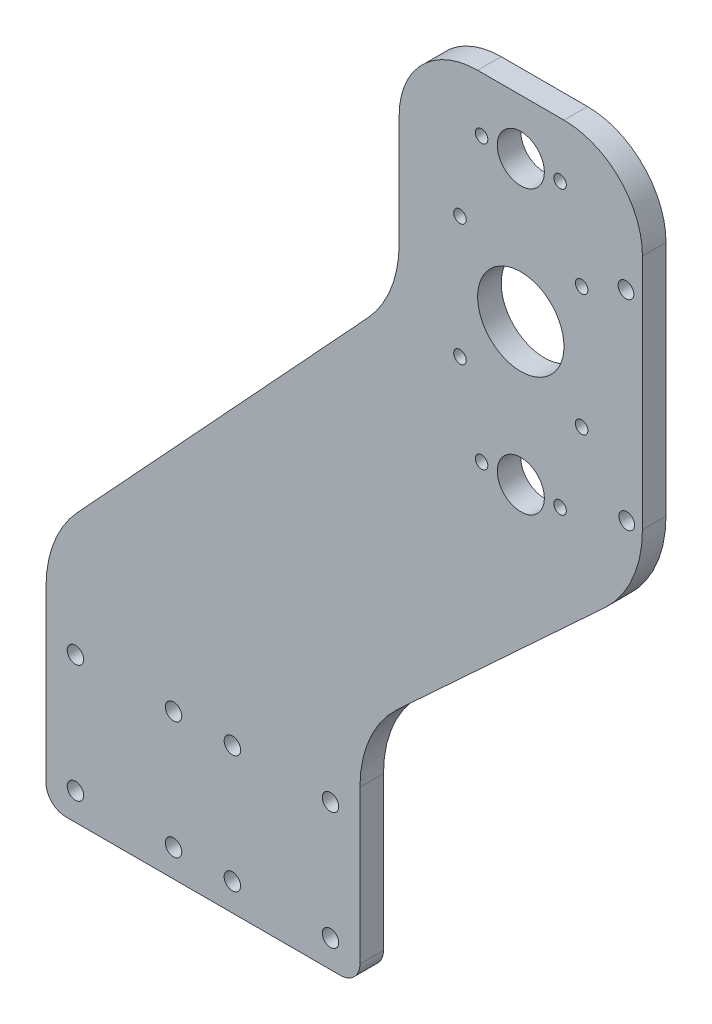
from build123d import *

# Parameters (mm, degrees)
SKETCH1_R           = 2.1
SKETCH1_R_2         = 6
SKETCH1_R_3         = 11
SKETCH1_R_4         = 1.6
SKETCH1_R_5         = 2
BOSS_EXTRUDE1_DEPTH = 6


with BuildPart() as part:
    # Sketch1 → Boss-Extrude1 (new body)
    with BuildSketch(Plane.XY):
        with BuildLine():
            Line((-58.450315728, -99.207311363), (11.549684272, -99.207311363))
            ThreePointArc((11.549684272, -99.207311363), (15.085218178, -97.742845269), (16.549684272, -94.207311363))
            Line((16.549684272, -94.207311363), (16.549684272, -55.206132823))
            ThreePointArc((16.549684272, -55.206132823), (19.062073387, -43.188177597), (26.178434127, -33.18314103))
            Line((26.178434127, -33.18314103), (78.920934418, 15.603630397))
            ThreePointArc((78.920934418, 15.603630397), (86.037295158, 25.608666964), (88.549684272, 37.62662219))
            Line((88.549684272, 37.62662219), (88.549684272, 98.042585462))
            ThreePointArc((88.549684272, 98.042585462), (82.691819896, 112.184721085), (68.549684272, 118.042585462))
            Line((68.549684272, 118.042585462), (46.549684272, 118.042585462))
            ThreePointArc((46.549684272, 118.042585462), (32.407548649, 112.184721085), (26.549684272, 98.042585462))
            Line((26.549684272, 98.042585462), (26.549684272, 69.794245525))
            ThreePointArc((26.549684272, 69.794245525), (24.483006881, 58.852148467), (18.567718404, 49.417637049))
            Line((18.567718404, 49.417637049), (-55.46834986, -30.582362951))
            ThreePointArc((-55.46834986, -30.582362951), (-61.383638337, -40.016874369), (-63.450315728, -50.958971426))
            Line((-63.450315728, -50.958971426), (-63.450315728, -94.207311363))
            ThreePointArc((-63.450315728, -94.207311363), (-61.985849634, -97.742845269), (-58.450315728, -99.207311363))
        make_face()
        with Locations((-55.950315728, -62.207311363)):
            Circle(SKETCH1_R, mode=Mode.SUBTRACT)
        with Locations((-30.950315728, -62.207311363)):
            Circle(SKETCH1_R, mode=Mode.SUBTRACT)
        with Locations((-30.950315728, -92.207311363)):
            Circle(SKETCH1_R, mode=Mode.SUBTRACT)
        with Locations((-55.950315728, -92.207311363)):
            Circle(SKETCH1_R, mode=Mode.SUBTRACT)
        with Locations((9.049684272, -92.207311363)):
            Circle(SKETCH1_R, mode=Mode.SUBTRACT)
        with Locations((-15.950315728, -92.207311363)):
            Circle(SKETCH1_R, mode=Mode.SUBTRACT)
        with Locations((-15.950315728, -62.207311363)):
            Circle(SKETCH1_R, mode=Mode.SUBTRACT)
        with Locations((9.049684272, -62.207311363)):
            Circle(SKETCH1_R, mode=Mode.SUBTRACT)
        with Locations((57.549684272, 104.042585462)):
            Circle(SKETCH1_R_2, mode=Mode.SUBTRACT)
        with Locations((57.549684272, 32.102585462)):
            Circle(SKETCH1_R_2, mode=Mode.SUBTRACT)
        with Locations((57.549684272, 68.072585462)):
            Circle(SKETCH1_R_3, mode=Mode.SUBTRACT)
        with Locations((42.049684272, 83.572585462)):
            Circle(SKETCH1_R_4, mode=Mode.SUBTRACT)
        with Locations((73.049684272, 83.572585462)):
            Circle(SKETCH1_R_4, mode=Mode.SUBTRACT)
        with Locations((73.049684272, 52.572585462)):
            Circle(SKETCH1_R_4, mode=Mode.SUBTRACT)
        with Locations((42.049684272, 52.572585462)):
            Circle(SKETCH1_R_4, mode=Mode.SUBTRACT)
        with Locations((84.549684272, 37.62662219)):
            Circle(SKETCH1_R_5, mode=Mode.SUBTRACT)
        with Locations((84.351781192, 88.518513838)):
            Circle(SKETCH1_R_5, mode=Mode.SUBTRACT)
        with Locations((47.549684272, 104.042585462)):
            Circle(SKETCH1_R_4, mode=Mode.SUBTRACT)
        with Locations((47.549684272, 32.102585462)):
            Circle(SKETCH1_R_4, mode=Mode.SUBTRACT)
        with Locations((67.549684272, 104.042585462)):
            Circle(SKETCH1_R_4, mode=Mode.SUBTRACT)
        with Locations((67.549684272, 32.102585462)):
            Circle(SKETCH1_R_4, mode=Mode.SUBTRACT)
    extrude(amount=BOSS_EXTRUDE1_DEPTH)


solid = part.part
